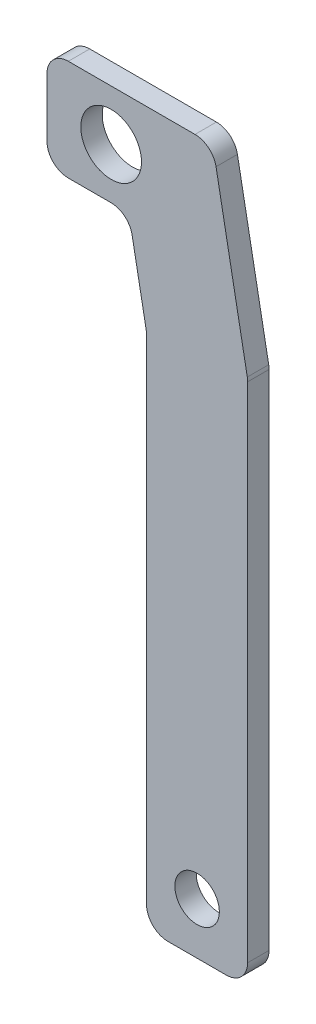
from build123d import *

# Parameters (mm, degrees)
BOSS_EXTRUDE1_DEPTH  = 3.175
M6_CLEARANCE_HOLE1_D = 6.6
FILLET1_R            = 3.175
M8_CLEARANCE_HOLE1_D = 9


with BuildPart() as part:
    # Sketch2 → Boss-Extrude1 (new body)
    with BuildSketch(Plane.XY):
        Polygon((-165.958708664, 206.01860883), (-153.810790701, 206.01860883), (-151.187872738, 192.04860883), (-151.187872738, 115.366389998), (-136.187872738, 115.366389998), (-136.187872738, 193.444565111), (-141.364999051, 221.01860883), (-165.958708664, 221.01860883), align=None)
    extrude(amount=BOSS_EXTRUDE1_DEPTH)

    # M6 Clearance Hole1 (through all)
    with Locations(Plane.XY.offset(3.175)):
        with Locations((-143.687872738, 122.986389998)):
            Hole(M6_CLEARANCE_HOLE1_D / 2)

    # Fillet1
    fillet1_edges = [part.edges().sort_by_distance(p)[0] for p in [
        (-151.187872738, 192.04860883, 1.5875),
        (-153.810790701, 206.01860883, 1.5875),
        (-141.364999051, 221.01860883, 1.5875),
        (-136.187872738, 193.444565111, 1.5875),
        (-165.958708664, 221.01860883, 1.5875),
        (-165.958708664, 206.01860883, 1.5875),
        (-151.187872738, 115.366389998, 1.5875),
        (-136.187872738, 115.366389998, 1.5875),
    ]]
    fillet(fillet1_edges, radius=FILLET1_R)

    # M8 Clearance Hole1 (through all)
    with Locations(Plane.XY.offset(3.175)):
        with Locations((-156.433708664, 213.51860883)):
            Hole(M8_CLEARANCE_HOLE1_D / 2)


solid = part.part
